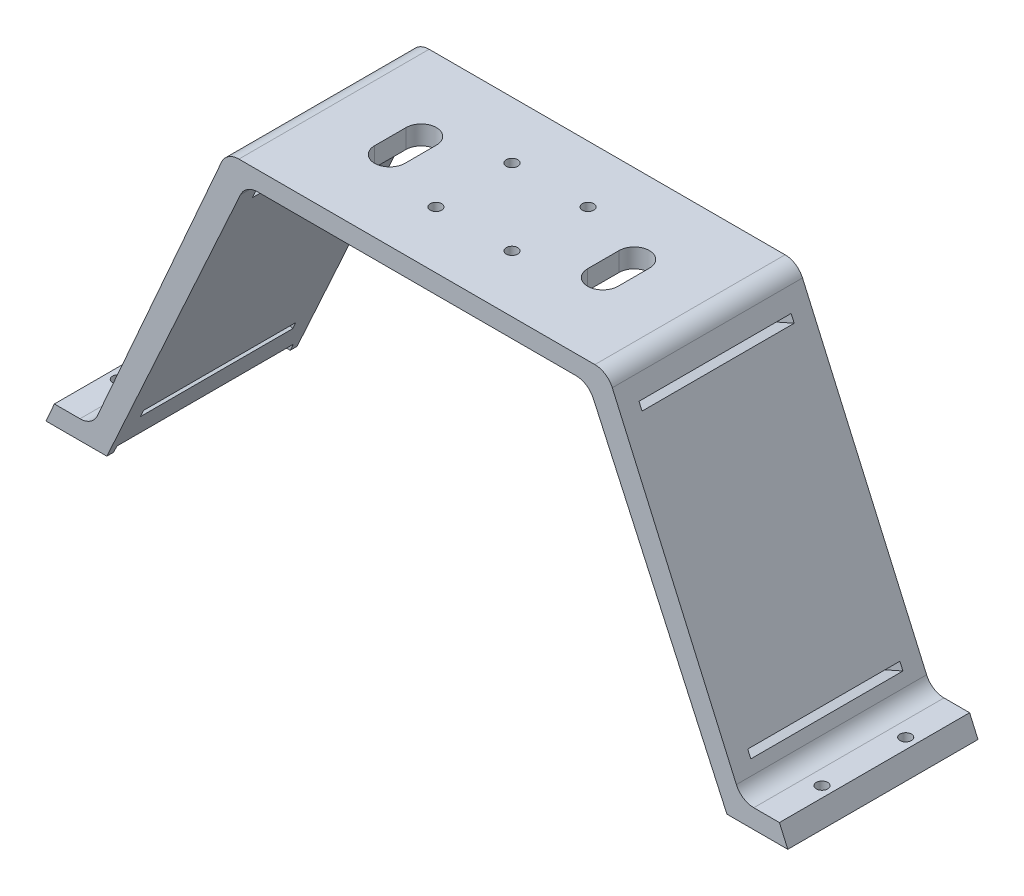
from build123d import *

# Parameters (mm, degrees)
BOSS_EXTRUDE2_DEPTH = 50
CUT_EXTRUDE1_DEPTH  = 50
FILLET1_R           = 5
SKETCH10_W          = 50
SKETCH10_H          = 5.46
BOSS_EXTRUDE4_DEPTH = 10
SKETCH5_W           = 50
SKETCH5_H           = 5.464
BOSS_EXTRUDE5_DEPTH = 10
SKETCH11_R          = 1.5
CUT_EXTRUDE2_DEPTH  = 10
SKETCH12_R          = 1.5
CUT_EXTRUDE3_DEPTH  = 10
FILLET2_R           = 5
FILLET3_R           = 5
SKETCH13_R          = 1.5
CUT_EXTRUDE5_DEPTH  = 10
SKETCH14_R          = 3
CUT_EXTRUDE6_DEPTH  = 2.5
CUT_EXTRUDE8_DEPTH  = 8.5
SKETCH18_W          = 15.2
SKETCH18_H          = 46.4
CUT_EXTRUDE14_DEPTH = 1.8
SKETCH19_W          = 15.2
SKETCH19_H          = 46.4
CUT_EXTRUDE15_DEPTH = 1.8
SKETCH16_W          = 40
SKETCH16_H          = 2
CUT_EXTRUDE16_DEPTH = 10
SKETCH17_W          = 40
SKETCH17_H          = 2
CUT_EXTRUDE17_DEPTH = 10


with BuildPart() as part:
    # Sketch1 → Boss-Extrude2 (new body)
    with BuildSketch(Plane.XY):
        Polygon((-87.5, 0), (87.5, 0), (50.05, 85), (-50.05, 85), align=None)
    extrude(amount=BOSS_EXTRUDE2_DEPTH)

    # Sketch3 → Cut-Extrude1 (cut)
    with BuildSketch(Plane.XY.offset(50)):
        Polygon((-81.5, 0), (81.5, 0), (45.05, 80), (-45.05, 80), align=None)
    extrude(amount=-CUT_EXTRUDE1_DEPTH, mode=Mode.SUBTRACT)

    # Fillet1
    fillet1_edges = [part.edges().sort_by_distance(p)[0] for p in [
        (45.05, 80, 25),
        (-45.05, 80, 25),
    ]]
    fillet(fillet1_edges, radius=FILLET1_R)

    # Sketch10 → Boss-Extrude4 (add, along a direction that is not the sketch's normal)
    with BuildSketch(Plane(origin=(-73.275840836, 32.284473404, 0), x_dir=(0, 0, 1), z_dir=(-0.9151164849241618, 0.4031895571812924, 0))):
        with Locations((25, -32.549086253)):
            Rectangle(SKETCH10_W, SKETCH10_H)
    extrude(amount=BOSS_EXTRUDE4_DEPTH, dir=(-1, 0, 0))

    # Sketch5 → Boss-Extrude5 (add, along a direction that is not the sketch's normal)
    with BuildSketch(Plane(origin=(73.275840836, 32.284473404, 0), x_dir=(0, 0, -1), z_dir=(0.9151164849241616, 0.4031895571812925, 0))):
        with Locations((-25, -32.547086253)):
            Rectangle(SKETCH5_W, SKETCH5_H)
    extrude(amount=BOSS_EXTRUDE5_DEPTH, dir=(1, 0, 0))

    # Sketch11 → Cut-Extrude2 (cut)
    with BuildSketch(Plane(origin=(0, 4.996536008, 0), x_dir=(1, 0, 0), z_dir=(0, 1, 0))):
        with Locations((-92.5, -14)):
            Circle(SKETCH11_R)
        with Locations((-92.5, -36)):
            Circle(SKETCH11_R)
    extrude(amount=-CUT_EXTRUDE2_DEPTH, mode=Mode.SUBTRACT)

    # Sketch12 → Cut-Extrude3 (cut)
    with BuildSketch(Plane(origin=(0, 5.000196474, 0), x_dir=(1, 0, 0), z_dir=(0, 1, 0))):
        with Locations((92.5, -14)):
            Circle(SKETCH12_R)
        with Locations((92.5, -36)):
            Circle(SKETCH12_R)
    extrude(amount=-CUT_EXTRUDE3_DEPTH, mode=Mode.SUBTRACT)

    # Fillet2
    fillet2_edges = [part.edges().sort_by_distance(p)[0] for p in [
        (85.29697226, 5.000196474, 25),
        (-85.298585018, 4.996536008, 25),
    ]]
    fillet(fillet2_edges, radius=FILLET2_R)

    # Fillet3
    fillet3_edges = [part.edges().sort_by_distance(p)[0] for p in [
        (50.05, 85, 25),
        (-50.05, 85, 25),
    ]]
    fillet(fillet3_edges, radius=FILLET3_R)

    # Sketch13 → Cut-Extrude5 (cut)
    with BuildSketch(Plane(origin=(0, 85, 0), x_dir=(1, 0, 0), z_dir=(0, 1, 0))):
        with Locations((-9.999155874, -15)):
            Circle(SKETCH13_R)
        with Locations((10.000844126, -15)):
            Circle(SKETCH13_R)
        with Locations((-9.999155874, -35)):
            Circle(SKETCH13_R)
        with Locations((10.000844126, -35)):
            Circle(SKETCH13_R)
    extrude(amount=-CUT_EXTRUDE5_DEPTH, mode=Mode.SUBTRACT)

    # Sketch14 → Cut-Extrude6 (cut)
    with BuildSketch(Plane.XZ.offset(-80)):
        with Locations((-9.999155874, 35)):
            Circle(SKETCH14_R)
        with Locations((-9.999155874, 15)):
            Circle(SKETCH14_R)
        with Locations((10.000844126, 35)):
            Circle(SKETCH14_R)
        with Locations((10.000844126, 15)):
            Circle(SKETCH14_R)
    extrude(amount=-CUT_EXTRUDE6_DEPTH, mode=Mode.SUBTRACT)

    # Sketch15 → Cut-Extrude8 (cut)
    with BuildSketch(Plane(origin=(0, 85, 0), x_dir=(1, 0, 0), z_dir=(0, 1, 0))):
        with BuildLine():
            Line((-23.999155874, -20.87), (-23.999155874, -29.13))
            ThreePointArc((-23.999155874, -29.13), (-27.999155874, -33.13), (-31.999155874, -29.13))
            Line((-31.999155874, -29.13), (-31.999155874, -20.87))
            ThreePointArc((-31.999155874, -20.87), (-27.999155874, -16.87), (-23.999155874, -20.87))
        make_face()
        with BuildLine():
            Line((32.000844126, -20.87), (32.000844126, -29.13))
            ThreePointArc((32.000844126, -29.13), (28.000844126, -33.13), (24.000844126, -29.13))
            Line((24.000844126, -29.13), (24.000844126, -20.87))
            ThreePointArc((24.000844126, -20.87), (28.000844126, -16.87), (32.000844126, -20.87))
        make_face()
    extrude(amount=-CUT_EXTRUDE8_DEPTH, mode=Mode.SUBTRACT)

    # Sketch18 → Cut-Extrude14 (cut)
    with BuildSketch(Plane.XZ):
        with Locations((88.1, 25)):
            Rectangle(SKETCH18_W, SKETCH18_H)
    extrude(amount=-CUT_EXTRUDE14_DEPTH, mode=Mode.SUBTRACT)

    # Sketch19 → Cut-Extrude15 (cut)
    with BuildSketch(Plane.XZ):
        with Locations((-88.1, 25)):
            Rectangle(SKETCH19_W, SKETCH19_H)
    extrude(amount=-CUT_EXTRUDE15_DEPTH, mode=Mode.SUBTRACT)

    # Sketch16 → Cut-Extrude16 (cut)
    with BuildSketch(Plane(origin=(73.275840836, 32.284473404, 0), x_dir=(0, 0, -1), z_dir=(0.9151164849241616, 0.4031895571812925, 0))):
        with Locations((-25, 48.344419756)):
            Rectangle(SKETCH16_W, SKETCH16_H)
        with Locations((-25, -22.554242128)):
            Rectangle(SKETCH16_W, SKETCH16_H)
    extrude(amount=-CUT_EXTRUDE16_DEPTH, mode=Mode.SUBTRACT)

    # Sketch17 → Cut-Extrude17 (cut)
    with BuildSketch(Plane(origin=(-73.275840836, 32.284473404, 0), x_dir=(0, 0, 1), z_dir=(-0.9151164849241618, 0.4031895571812924, 0))):
        with Locations((25, 48.344419756)):
            Rectangle(SKETCH17_W, SKETCH17_H)
        with Locations((25, -22.558242128)):
            Rectangle(SKETCH17_W, SKETCH17_H)
    extrude(amount=-CUT_EXTRUDE17_DEPTH, mode=Mode.SUBTRACT)


solid = part.part
